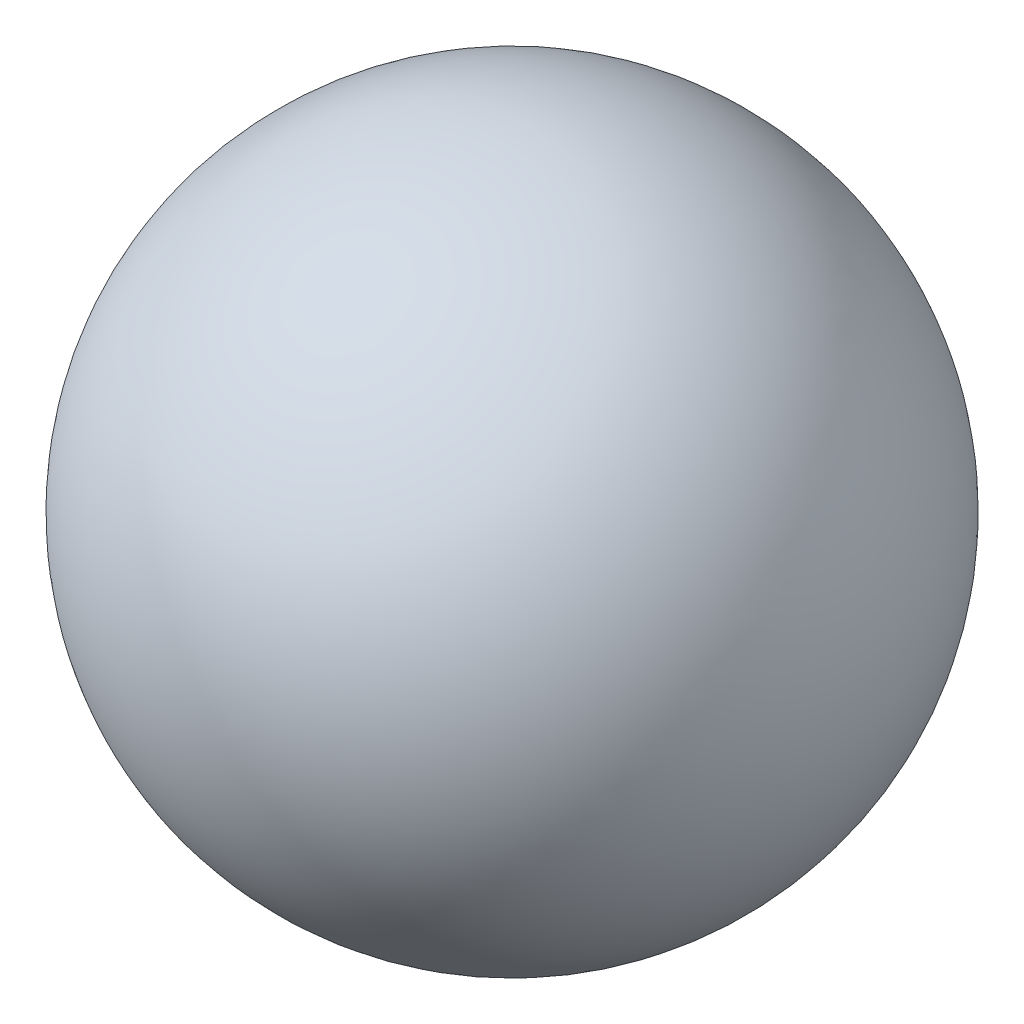
from build123d import *


with BuildPart() as part:
    # 草图1 → 旋转4 (revolve)
    with BuildSketch(Plane(origin=(0, 0, 0), x_dir=(1, 0, 0), z_dir=(0, 1, 0))):
        with BuildLine():
            Line((0, 8.5), (0, -8.5))
            ThreePointArc((0, -8.5), (-8.5, 0), (0, 8.5))
        make_face()
    revolve(axis=Axis((0, 0, 0), (0, 0, -1)))


solid = part.part
